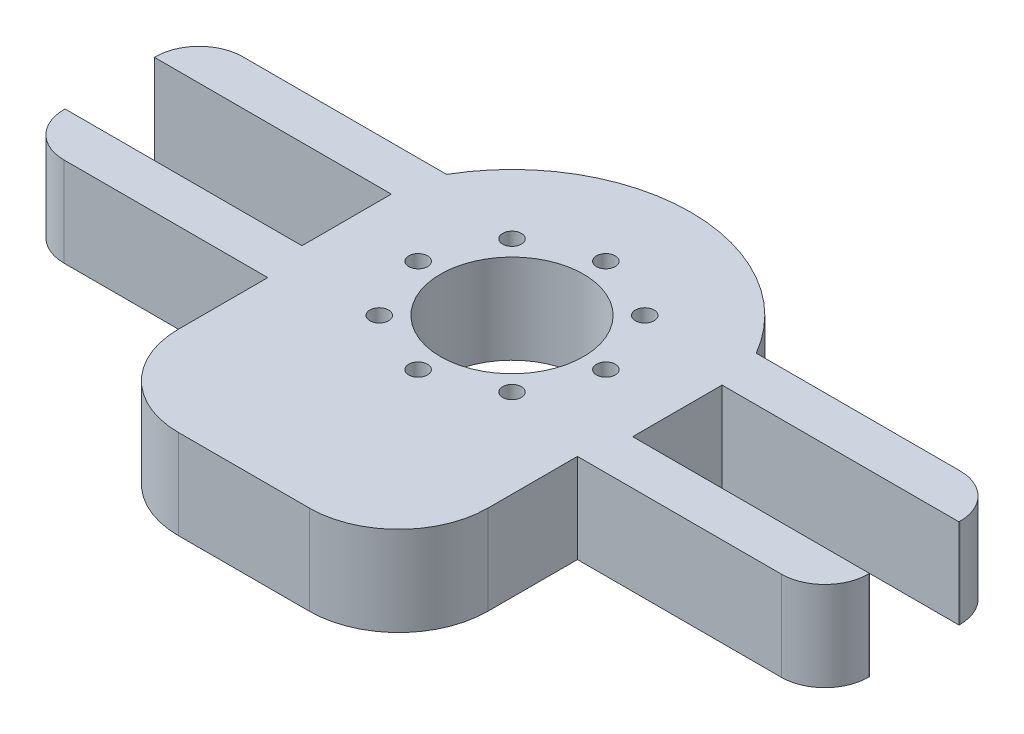
from build123d import *
from build123d.topology import SkipClean

# Parameters (mm, degrees)
BOSS_EXTRUDE1_DEPTH  = 20
SKETCH2_W            = 53
SKETCH2_H            = 20
CUT_EXTRUDE1_DEPTH   = 20
FILLET1_R            = 9.75
FILLET1_OF_MIRROR4_R = 9.75
SKETCH4_R            = 2.1
CUT_EXTRUDE3_DEPTH   = 20
FILLET2_R            = 20


with BuildPart() as part:
    # Sketch1 → Boss-Extrude1 (new body)
    with BuildSketch(Plane(origin=(0, 0, 0), x_dir=(1, 0, 0), z_dir=(0, 1, 0))):
        with BuildLine():
            Line((34.641016151, 20), (90, 20))
            Line((90, 20), (90, -20))
            Line((90, -20), (34.641016151, -20))
            Line((34.641016151, -20), (34.641016151, -60))
            Line((34.641016151, -60), (0, -60))
            Line((0, -60), (0, -20))
            Line((0, -20), (0, 20))
            Line((0, 20), (0, 40))
            ThreePointArc((0, 40), (20, 34.641016151), (34.641016151, 20))
        make_face()
    boss_extrude1 = extrude(amount=BOSS_EXTRUDE1_DEPTH)

    # Sketch2 → Cut-Extrude1 (cut)
    with BuildSketch(Plane(origin=(0, 20, 0), x_dir=(1, 0, 0), z_dir=(0, 1, 0))):
        with BuildLine():
            Line((0, 16), (0, -16))
            ThreePointArc((0, -16), (16, 0), (0, 16))
        make_face()
        with Locations((63.5, 0)):
            Rectangle(SKETCH2_W, SKETCH2_H)
    cut_extrude1 = extrude(amount=-CUT_EXTRUDE1_DEPTH, mode=Mode.SUBTRACT)

    # Fillet1
    fillet1_edges = [part.edges().sort_by_distance(p)[0] for p in [
        (90, 10, -20),
        (90, 10, 20),
    ]]
    fillet(fillet1_edges, radius=FILLET1_R)

    # Mirror4: Boss-Extrude1, Cut-Extrude1 across plane
    with SkipClean():  # the faces are left unmerged after this step: merging them gives an invalid solid
        add(boss_extrude1.mirror(Plane(origin=(0, 0, 0), x_dir=(0, 0, 1), z_dir=(1, 0, 0))))
        add(cut_extrude1.mirror(Plane(origin=(0, 0, 0), x_dir=(0, 0, 1), z_dir=(1, 0, 0))), mode=Mode.SUBTRACT)
    add(part.part.scale(1), mode=Mode.REPLACE)  # the faces are merged on a copy

    # Fillet1 of Mirror4
    fillet1_of_mirror4_edges = [part.edges().sort_by_distance(p)[0] for p in [
        (-90, 10, -20),
        (-90, 10, 20),
    ]]
    fillet(fillet1_of_mirror4_edges, radius=FILLET1_OF_MIRROR4_R)

    # Sketch4 → Cut-Extrude3 (cut)
    with BuildSketch(Plane(origin=(0, 20, 0), x_dir=(1, 0, 0), z_dir=(0, 1, 0))):
        with Locations(Location((21, 0, 0), (0, 0, 270))):
            Circle(SKETCH4_R)
        with Locations(Location((14.849242405, -14.849242405, 0), (0, 0, 270))):
            Circle(SKETCH4_R)
        with Locations(Location((0, -21, 0), (0, 0, 270))):
            Circle(SKETCH4_R)
        with Locations(Location((-14.849242405, -14.849242405, 0), (0, 0, 270))):
            Circle(SKETCH4_R)
        with Locations(Location((-21, 0, 0), (0, 0, 270))):
            Circle(SKETCH4_R)
        with Locations(Location((-14.849242405, 14.849242405, 0), (0, 0, 270))):
            Circle(SKETCH4_R)
        with Locations(Location((0, 21, 0), (0, 0, 270))):
            Circle(SKETCH4_R)
        with Locations(Location((14.849242405, 14.849242405, 0), (0, 0, 270))):
            Circle(SKETCH4_R)
    extrude(amount=-CUT_EXTRUDE3_DEPTH, mode=Mode.SUBTRACT)

    # Fillet2
    fillet2_edges = [part.edges().sort_by_distance(p)[0] for p in [
        (34.641016151, 10, 60),
        (-34.641016151, 10, 60),
    ]]
    fillet(fillet2_edges, radius=FILLET2_R)


solid = part.part
